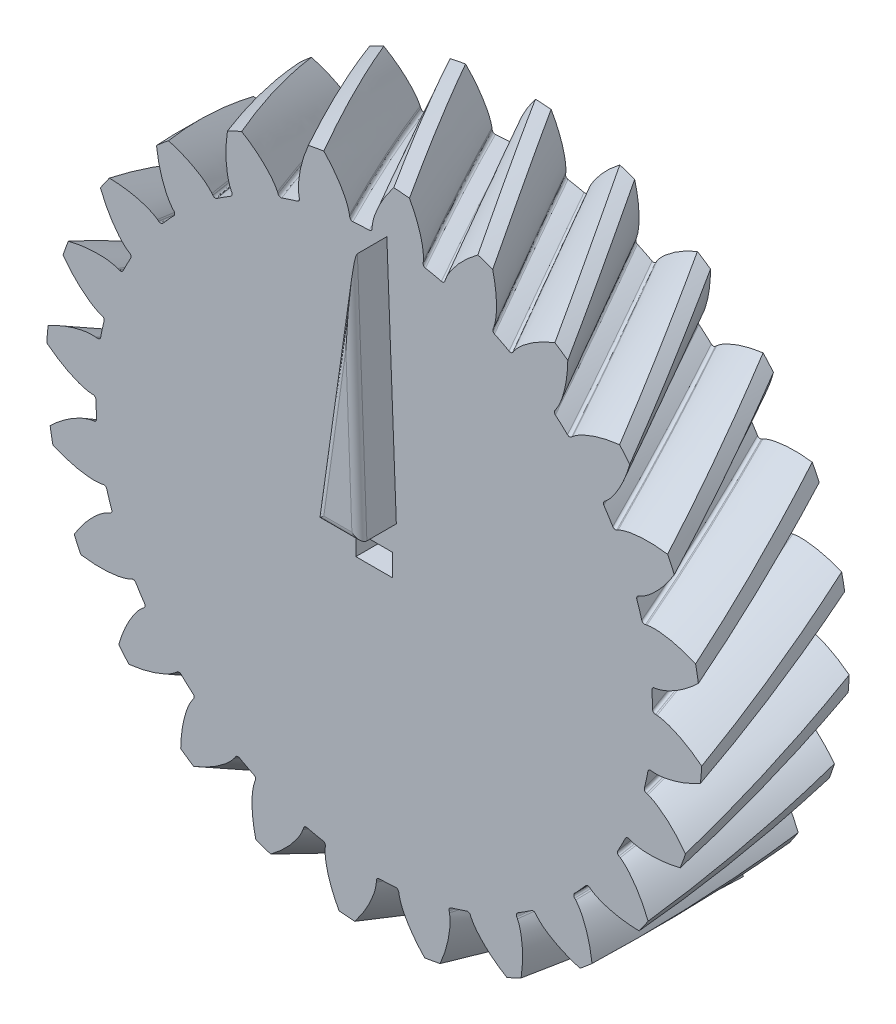
from build123d import *

# Parameters (mm, degrees)
SKETCH1_R           = 37.8192
BOSS_EXTRUDE1_DEPTH = 20
SWEEP1_PITCH        = 450.9
SWEEP1_HEIGHT       = 20
SWEEP1_RADIUS       = 41.5692194
SWEEP1_START_ANGLE  = 154.78281511
CIRPATTERN1_COUNT   = 24
SKETCH9_W           = 5
SKETCH9_H           = 3
CUT_EXTRUDE1_DEPTH  = 67.127381843
BOSS_EXTRUDE2_DEPTH = 5
FILLET1_R           = 1


with BuildPart() as part:
    # Sketch1 → Boss-Extrude1 (new body)
    with BuildSketch(Plane.XY):
        Circle(SKETCH1_R)
    extrude(amount=BOSS_EXTRUDE1_DEPTH)

    # Sweep1: sweep along a helix
    with BuildLine() as sweep1_path:
        add(Helix(SWEEP1_PITCH, SWEEP1_HEIGHT, SWEEP1_RADIUS, center=(0, 0, 20), direction=(0, 0, -1), lefthand=True, mode=Mode.PRIVATE).rotate(Axis((0, 0, 20), (0, 0, -1)), SWEEP1_START_ANGLE))
    with BuildLine() as sweep1_axis:
        Line((0, 0, 20), (0, 0, 0))
    # Sketch4 → Sweep1 (sweep)
    with BuildSketch(Plane.XY.offset(20)):
        with BuildLine():
            Line((32.951170147, 19.358916153), (32.969321044, 19.369579862))
            ThreePointArc((32.969321044, 19.369579862), (33.053490705, 19.416341597), (33.139813444, 19.458998091))
            add(Edge.make_bspline(
                [(33.139813444, 19.458998091), (33.283546692, 19.525768675), (33.968082786, 19.805325682), (35.654613848, 20.143395205), (37.771473082, 20.197896548), (39.296349237, 20.033565152), (39.855004262, 19.949785759)],
                knots=[0.011706316, 0.011706316, 0.011706316, 0.011706316, 0.063015422, 0.251582102, 0.564552919, 0.747319326, 0.747319326, 0.747319326, 0.747319326], degree=3))
            ThreePointArc((39.855004262, 19.949785759), (40.321741869, 18.98874533), (40.76530962, 18.016793505))
            add(Edge.make_bspline(
                [(36.109644467, 13.152696235), (36.252670178, 13.220969242), (36.904202663, 13.57060792), (38.23907457, 14.655409753), (39.629447603, 16.252571688), (40.474052936, 17.532764613), (40.76530962, 18.016793505)],
                knots=[0.011706316, 0.011706316, 0.011706316, 0.011706316, 0.063015422, 0.251582102, 0.564552919, 0.747319326, 0.747319326, 0.747319326, 0.747319326], degree=3))
            ThreePointArc((36.109644467, 13.152696235), (36.021776493, 13.113320978), (35.932115236, 13.0782204))
            Line((35.932115236, 13.0782204), (35.912333204, 13.071020329))
            ThreePointArc((35.912333204, 13.071020329), (35.687507743, 12.86608537), (35.671852975, 12.562276625))
            ThreePointArc((35.671852975, 12.562276625), (34.215004013, 16.112895117), (32.405805239, 19.497581272))
            ThreePointArc((32.405805239, 19.497581272), (32.649981513, 19.316134936), (32.951170147, 19.358916153))
        make_face()
    sweep1 = sweep(path=sweep1_path.line, binormal=sweep1_axis.edges()[0])

    # CirPattern1: Sweep1 ×24 about axis
    cirpattern1_axis = Axis((0, 0, 0), (0, 0, -1))
    for i in range(1, CIRPATTERN1_COUNT):
        add(sweep1.rotate(cirpattern1_axis, i * 360 / CIRPATTERN1_COUNT))

    # Sketch9 → Cut-Extrude1 (cut, through all)
    with BuildSketch(Plane.XY.offset(20)):
        Rectangle(SKETCH9_W, SKETCH9_H)
    extrude(amount=-CUT_EXTRUDE1_DEPTH, mode=Mode.SUBTRACT)

    # Sketch10 → Boss-Extrude2 (add)
    with BuildSketch(Plane.XY.offset(20)):
        Polygon((3, 5.105002932), (-3, 5.105002932), (1.710054827, 38.252221721), align=None)
    extrude(amount=BOSS_EXTRUDE2_DEPTH)

    # Fillet1
    fillet1_edges = [part.edges().sort_by_distance(p)[0] for p in [
        (2.355027413, 21.678612327, 25),
        (-0.644972587, 21.678612327, 25),
        (0, 5.105002932, 25),
    ]]
    fillet(fillet1_edges, radius=FILLET1_R)


solid = part.part
